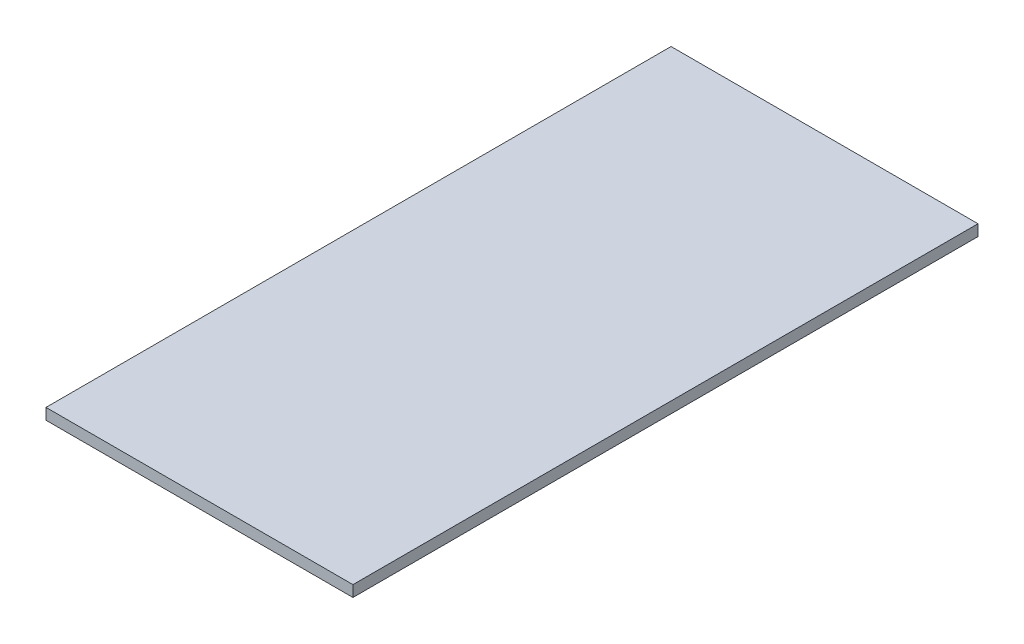
from build123d import *

# Parameters (mm, degrees)
SKETCH1_W           = 174.625
SKETCH1_H           = 355.6
BOSS_EXTRUDE1_DEPTH = 6.35


with BuildPart() as part:
    # Sketch1 → Boss-Extrude1 (new body)
    with BuildSketch(Plane(origin=(0, 0, 0), x_dir=(1, 0, 0), z_dir=(0, 1, 0))):
        Rectangle(SKETCH1_W, SKETCH1_H)
    extrude(amount=BOSS_EXTRUDE1_DEPTH)


solid = part.part
